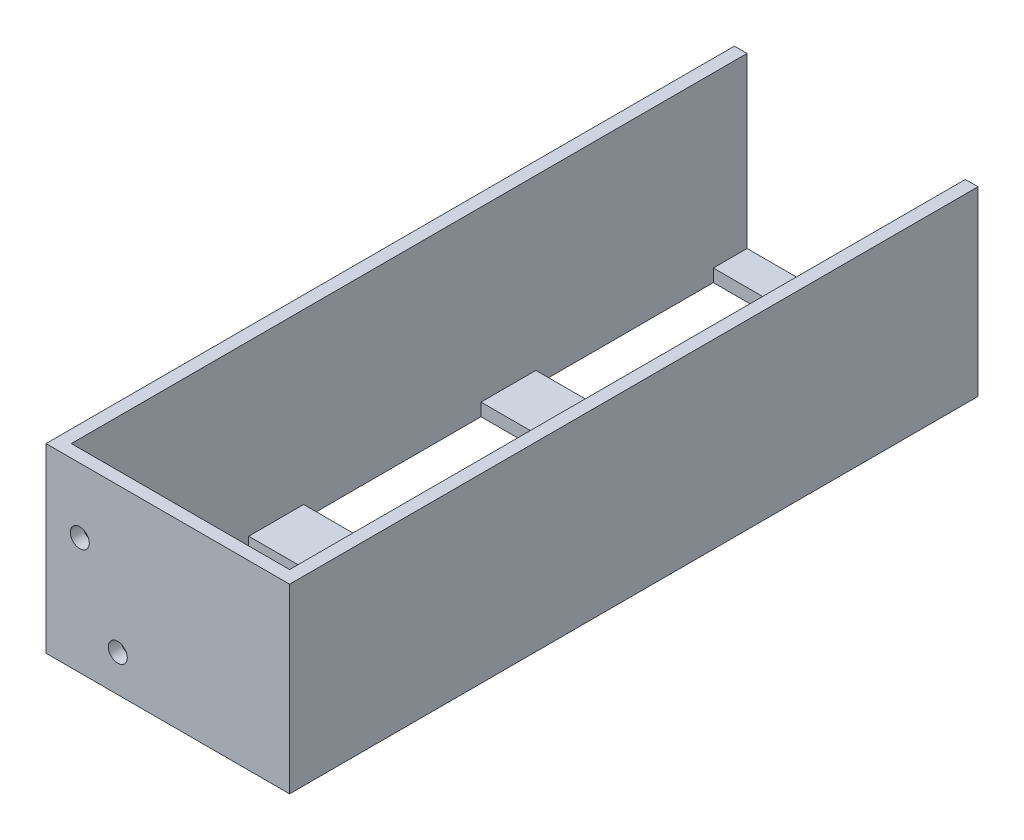
from build123d import *

# Parameters (mm, degrees)
BOSS_EXTRUDE1_DEPTH = 160
SKETCH2_W           = 45
SKETCH2_H           = 42
CUT_EXTRUDE1_DEPTH  = 175.467036895
BOSS_EXTRUDE2_DEPTH = 3
CUT_EXTRUDE2_REACH  = 179.222
SKETCH4_R           = 2.25


with BuildPart() as part:
    # Sketch1 → Boss-Extrude1 (new body)
    with BuildSketch(Plane.XY):
        Polygon((0, 0), (0, -10), (0, -40), (51.678578647, -40), (51.678578647, 0), (54.678578647, 0), (54.678578647, -43), (-3, -43), (-3, -10), (-3, 0), align=None)
    extrude(amount=BOSS_EXTRUDE1_DEPTH)

    # Sketch2 → Cut-Extrude1 (cut, through all)
    with BuildSketch(Plane(origin=(0, 0, 0), x_dir=(1, 0, 0), z_dir=(0, 1, 0))):
        with Locations((22.5, -29)):
            Rectangle(SKETCH2_W, SKETCH2_H)
        with Locations((22.5, -84)):
            Rectangle(SKETCH2_W, SKETCH2_H)
        with Locations((22.5, -139)):
            Rectangle(SKETCH2_W, SKETCH2_H)
    extrude(amount=-CUT_EXTRUDE1_DEPTH, mode=Mode.SUBTRACT)

    # Sketch3 → Boss-Extrude2 (add)
    with BuildSketch(Plane.XY.offset(160)):
        Polygon((-3, 0), (54.678578647, 0), (54.678578647, -43), (0, -43), (-3, -43), align=None)
    extrude(amount=BOSS_EXTRUDE2_DEPTH)

    # Sketch4 → Cut-Extrude2 (cut, up to next)
    with BuildSketch(Plane.XY.offset(163), mode=Mode.PRIVATE) as cut_extrude2_sk1:
        with Locations((14, -34.29951212)):
            Circle(SKETCH4_R)
    cut_extrude2_tool1 = extrude(cut_extrude2_sk1.sketch, amount=-CUT_EXTRUDE2_REACH, mode=Mode.PRIVATE) & part.part
    # Sketch4 → Cut-Extrude2 (cut, up to next)
    with BuildSketch(Plane.XY.offset(163), mode=Mode.PRIVATE) as cut_extrude2_sk2:
        with Locations((5, -15.310588783)):
            Circle(SKETCH4_R)
    cut_extrude2_tool2 = extrude(cut_extrude2_sk2.sketch, amount=-CUT_EXTRUDE2_REACH, mode=Mode.PRIVATE) & part.part
    add(cut_extrude2_tool1.solids().sort_by_distance((14, -34.299512, 163))[0], mode=Mode.SUBTRACT)
    add(cut_extrude2_tool2.solids().sort_by_distance((5, -15.310589, 163))[0], mode=Mode.SUBTRACT)


solid = part.part
